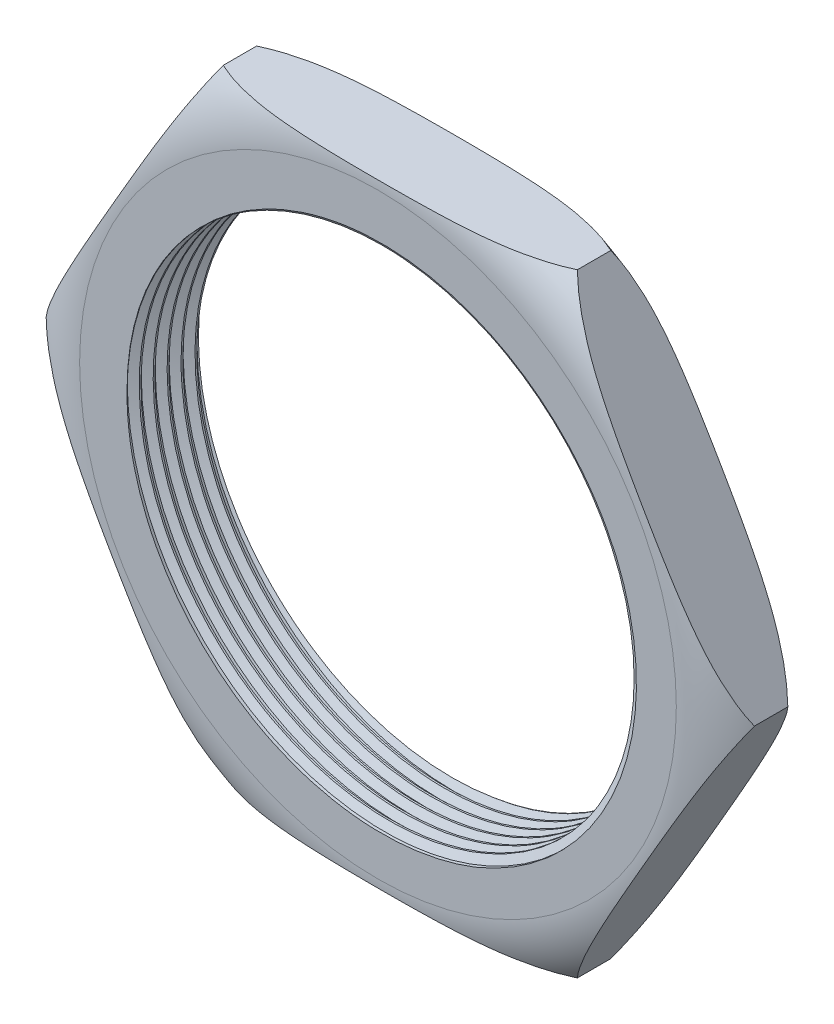
from build123d import *

# Parameters (mm, degrees)
BOSS_EXTRUDE1_DEPTH = 2.8
CUT_EXTRUDE1_REACH  = 19.034
SKETCH2_R           = 9
THREAD1_PITCH       = 0.5


with BuildPart() as part:
    # Sketch1 → Boss-Extrude1 (new body)
    with BuildSketch(Plane.XY):
        Polygon((6.350852961, -11), (12.701705922, 0), (6.350852961, 11), (-6.350852961, 11), (-12.701705922, 0), (-6.350852961, -11), align=None)
    extrude(amount=BOSS_EXTRUDE1_DEPTH)

    # Sketch2 → Cut-Extrude1 (cut, up to next)
    with BuildSketch(Plane.XY.offset(2.8), mode=Mode.PRIVATE) as cut_extrude1_sk1:
        Circle(SKETCH2_R)
    cut_extrude1_tool1 = extrude(cut_extrude1_sk1.sketch, amount=-CUT_EXTRUDE1_REACH, mode=Mode.PRIVATE) & part.part
    add(cut_extrude1_tool1.solids().sort_by_distance((0, 0, 2.8))[0], mode=Mode.SUBTRACT)

    # Sketch3 → Cut-Revolve1 (revolve, cut)
    with BuildSketch(Plane(origin=(0, 0, 0), x_dir=(1, 0, 0), z_dir=(0, 1, 0))):
        with BuildLine():
            Line((-12.701705922, -0.8), (-12.701705922, 0))
            Line((-12.701705922, 0), (-10.701705922, 0))
            ThreePointArc((-10.701705922, 0), (-11.778738884, -0.207417596), (-12.701705922, -0.8))
        make_face()
        with BuildLine():
            Line((-12.701705922, -2), (-12.701705922, -2.8))
            Line((-12.701705922, -2.8), (-10.701705922, -2.8))
            ThreePointArc((-10.701705922, -2.8), (-11.778738884, -2.592582404), (-12.701705922, -2))
        make_face()
    revolve(axis=Axis((0, 0, 0), (0, 0, 1)), mode=Mode.SUBTRACT)

    # Thread1: the profile of Thread Profile1 profile screwed along a right-hand helix of 7.6 turns, 6 arcs to a turn; built about Z, then put on its axis
    thread1_z = Axis((0, 0, 0), (0, 0, 1))
    thread1_corners = [(8.9997, 0, -0.000173205), (8.9997, 0, 0.437673204), (9.270632938, 0, 0.281249999), (9.270632938, 0, 0.156249999)]
    with BuildLine(mode=Mode.PRIVATE) as thread1_profile:
        Line(thread1_corners[0], thread1_corners[1])
        Line(thread1_corners[1], thread1_corners[2])
        Line(thread1_corners[2], thread1_corners[3])
        Line(thread1_corners[3], thread1_corners[0])
    thread1_cap = Face(thread1_profile.wire())
    thread1_turn_angles = [0, 30, 60, 90, 120, 150, 180, 210, 240, 270, 300, 330, 360]
    thread1_turn_weights = [1, 0.8660254037844387, 1, 0.8660254037844387, 1, 0.8660254037844387, 1, 0.8660254037844387, 1, 0.8660254037844387, 1, 0.8660254037844387, 1]
    thread1_turn_rails = [Edge.make_bspline([Vector(p[0], p[1], 0).rotate(thread1_z, thread1_turn_angles[k]) / thread1_turn_weights[k] + Vector(0, 0, p[2] + THREAD1_PITCH * thread1_turn_angles[k] / 360) for k in range(13)], [0, 0, 0, 1, 1, 2, 2, 3, 3, 4, 4, 5, 5, 6, 6, 6], 2, thread1_turn_weights) for p in thread1_corners]
    thread1_turn_sides = [Face.make_surface_from_curves(thread1_turn_rails[p[0]], thread1_turn_rails[p[1]]) for p in [(0, 1), (1, 2), (2, 3), (3, 0)]]
    thread1_last_angles = [2520, 2550, 2580, 2610, 2640, 2670, 2700, 2718, 2736]
    thread1_last_weights = [1, 0.8660254037844387, 1, 0.8660254037844387, 1, 0.8660254037844387, 1, 0.9510565162951535, 1]
    thread1_last_rails = [Edge.make_bspline([Vector(p[0], p[1], 0).rotate(thread1_z, thread1_last_angles[k]) / thread1_last_weights[k] + Vector(0, 0, p[2] + THREAD1_PITCH * thread1_last_angles[k] / 360) for k in range(9)], [0, 0, 0, 1, 1, 2, 2, 3, 3, 4, 4, 4], 2, thread1_last_weights) for p in thread1_corners]
    thread1_last_sides = [Face.make_surface_from_curves(thread1_last_rails[p[0]], thread1_last_rails[p[1]]) for p in [(0, 1), (1, 2), (2, 3), (3, 0)]]
    thread1 = Plane(origin=(0, 0, 3.8), x_dir=(-1, 0, 0), z_dir=(0, 0, -1)) * Solid(Shell([*[p.moved(Location((0, 0, THREAD1_PITCH * i))) for i in range(7) for p in thread1_turn_sides], *thread1_last_sides, thread1_cap, thread1_cap.rotate(thread1_z, 2736).moved(Location((0, 0, THREAD1_PITCH * 2736 / 360)))]))
    add(thread1, mode=Mode.SUBTRACT)


solid = part.part
